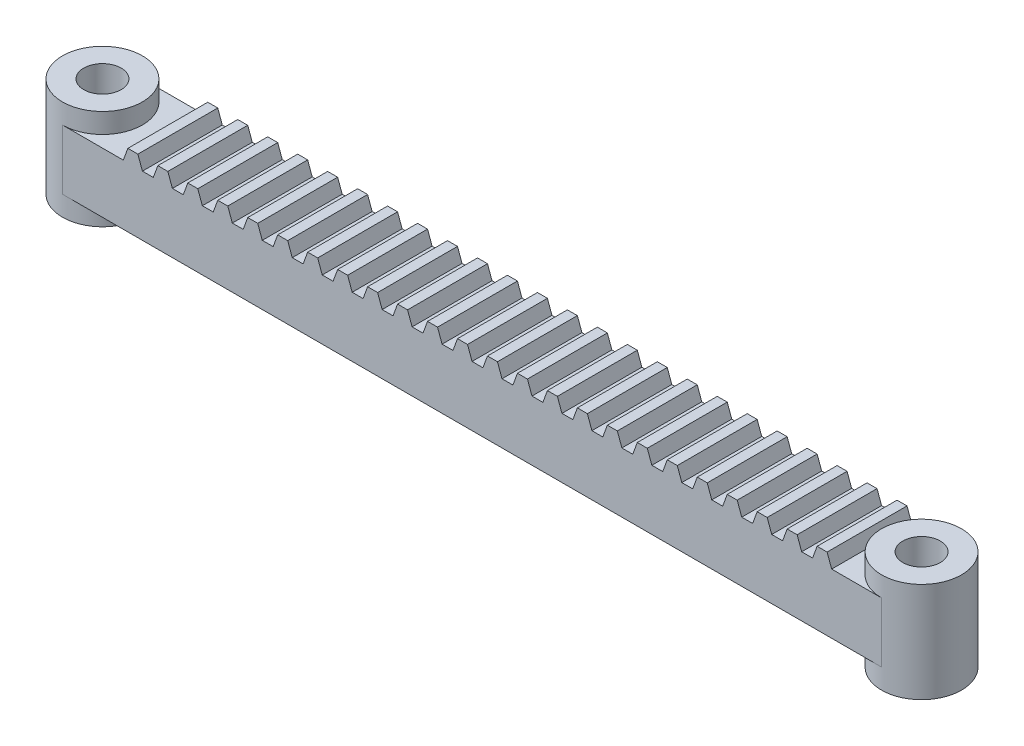
from build123d import *

# Parameters (mm, degrees)
BOSS_EXTRUDE1_DEPTH = 16
BOSS_EXTRUDE2_DEPTH = 16
BOSS_EXTRUDE3_DEPTH = 16
SKETCH2_R           = 8
SKETCH2_R_2         = 3.75
BOSS_EXTRUDE4_DEPTH = 4
BOSS_EXTRUDE5_START = -16
SKETCH2_3_R         = 8
SKETCH2_3_R_2       = 3.75
BOSS_EXTRUDE5_DEPTH = 16
CUT_EXTRUDE1_START  = -16
CUT_EXTRUDE1_DEPTH  = 16
BOSS_EXTRUDE6_START = -16
SKETCH2_5_R         = 8
SKETCH2_5_R_2       = 3.75
BOSS_EXTRUDE6_DEPTH = 16
SKETCH2_6_R         = 8
SKETCH2_6_R_2       = 3.75
BOSS_EXTRUDE7_DEPTH = 4
CUT_EXTRUDE2_START  = -16
SKETCH2_7_R         = 3.75
CUT_EXTRUDE2_DEPTH  = 16


with BuildPart() as part:
    # Sketch1 → Boss-Extrude1 (new body)
    with BuildSketch(Plane.XY):
        Polygon((70.090074414, 0), (70.090074414, 12), (68.180148829, 12), (66, 12), (62.180148829, 12), (60, 12), (56.180148829, 12), (54, 12), (50.180148829, 12), (48, 12), (44.180148829, 12), (42, 12), (38.180148829, 12), (36, 12), (32.180148829, 12), (30, 12), (26.180148829, 12), (24, 12), (20.180148829, 12), (18, 12), (14.180148829, 12), (12, 12), (8.180148829, 12), (6, 12), (2.180148829, 12), (0, 12), (-3.819851171, 12), (-6, 12), (-9.819851171, 12), (-12, 12), (-15.819851171, 12), (-18, 12), (-21.819851171, 12), (-24, 12), (-27.819851171, 12), (-30, 12), (-33.819851171, 12), (-36, 12), (-39.819851171, 12), (-42, 12), (-45.819851171, 12), (-48, 12), (-51.819851171, 12), (-54, 12), (-57.819851171, 12), (-60, 12), (-63.819851171, 12), (-66, 12), (-69.819851171, 12), (-82, 12), (-82, 0), align=None)
    extrude(amount=BOSS_EXTRUDE1_DEPTH)

    # Sketch1<5> → Boss-Extrude2 (add)
    with BuildSketch(Plane.XY):
        Polygon((71.090074414, 14.5), (69.090074414, 14.5), (68.180148829, 12), (70.090074414, 12), (70.090074414, 0), (82, 0), (82, 12), (72, 12), align=None)
        Polygon((62.180148829, 12), (66, 12), (65.090074414, 14.5), (63.090074414, 14.5), align=None)
        Polygon((56.180148829, 12), (60, 12), (59.090074414, 14.5), (57.090074414, 14.5), align=None)
        Polygon((50.180148829, 12), (54, 12), (53.090074414, 14.5), (51.090074414, 14.5), align=None)
        Polygon((44.180148829, 12), (48, 12), (47.090074414, 14.5), (45.090074414, 14.5), align=None)
        Polygon((38.180148829, 12), (42, 12), (41.090074414, 14.5), (39.090074414, 14.5), align=None)
        Polygon((32.180148829, 12), (36, 12), (35.090074414, 14.5), (33.090074414, 14.5), align=None)
        Polygon((26.180148829, 12), (30, 12), (29.090074414, 14.5), (27.090074414, 14.5), align=None)
        Polygon((20.180148829, 12), (24, 12), (23.090074414, 14.5), (21.090074414, 14.5), align=None)
        Polygon((14.180148829, 12), (18, 12), (17.090074414, 14.5), (15.090074414, 14.5), align=None)
        Polygon((8.180148829, 12), (12, 12), (11.090074414, 14.5), (9.090074414, 14.5), align=None)
        Polygon((2.180148829, 12), (6, 12), (5.090074414, 14.5), (3.090074414, 14.5), align=None)
        Polygon((-14.909925586, 14.5), (-15.819851171, 12), (-12, 12), (-12.909925586, 14.5), align=None)
        Polygon((-3.819851171, 12), (0, 12), (-0.909925586, 14.5), (-2.909925586, 14.5), align=None)
        Polygon((-8.909925586, 14.5), (-9.819851171, 12), (-6, 12), (-6.909925586, 14.5), align=None)
    extrude(amount=BOSS_EXTRUDE2_DEPTH)

    # Sketch1<6> → Boss-Extrude3 (add)
    with BuildSketch(Plane.XY):
        Polygon((-68.909925586, 14.5), (-69.819851171, 12), (-66, 12), (-66.909925586, 14.5), align=None)
        Polygon((-62.909925586, 14.5), (-63.819851171, 12), (-60, 12), (-60.909925586, 14.5), align=None)
        Polygon((-56.909925586, 14.5), (-57.819851171, 12), (-54, 12), (-54.909925586, 14.5), align=None)
        Polygon((-50.909925586, 14.5), (-51.819851171, 12), (-48, 12), (-48.909925586, 14.5), align=None)
        Polygon((-44.909925586, 14.5), (-45.819851171, 12), (-42, 12), (-42.909925586, 14.5), align=None)
        Polygon((-38.909925586, 14.5), (-39.819851171, 12), (-36, 12), (-36.909925586, 14.5), align=None)
        Polygon((-32.909925586, 14.5), (-33.819851171, 12), (-30, 12), (-30.909925586, 14.5), align=None)
        Polygon((-26.909925586, 14.5), (-27.819851171, 12), (-24, 12), (-24.909925586, 14.5), align=None)
        Polygon((-20.909925586, 14.5), (-21.819851171, 12), (-18, 12), (-18.909925586, 14.5), align=None)
    extrude(amount=BOSS_EXTRUDE3_DEPTH)

    # Sketch2 → Boss-Extrude4 (add)
    with BuildSketch(Plane(origin=(0, 12, 0), x_dir=(1, 0, 0), z_dir=(0, 1, 0))):
        with Locations((-82, -8)):
            Circle(SKETCH2_R)
        with Locations((-82, -8)):
            Circle(SKETCH2_R_2, mode=Mode.SUBTRACT)
    extrude(amount=BOSS_EXTRUDE4_DEPTH)

    # Sketch2<3> → Boss-Extrude5 (add)
    with BuildSketch(Plane(origin=(0, 12, 0), x_dir=(1, 0, 0), z_dir=(0, 1, 0)).offset(BOSS_EXTRUDE5_START)):
        with Locations((-82, -8)):
            Circle(SKETCH2_3_R)
        with Locations((-82, -8)):
            Circle(SKETCH2_3_R_2, mode=Mode.SUBTRACT)
    extrude(amount=BOSS_EXTRUDE5_DEPTH)

    # Sketch2<4> → Cut-Extrude1 (cut)
    with BuildSketch(Plane(origin=(0, 12, 0), x_dir=(1, 0, 0), z_dir=(0, 1, 0)).offset(CUT_EXTRUDE1_START)):
        with BuildLine():
            ThreePointArc((-78.25, -8), (-79.348349571, -5.348349571), (-82, -4.25))
            Line((-82, -4.25), (-82, -11.75))
            ThreePointArc((-82, -11.75), (-79.348349571, -10.651650429), (-78.25, -8))
        make_face()
    extrude(amount=CUT_EXTRUDE1_DEPTH, mode=Mode.SUBTRACT)

    # Sketch2<5> → Boss-Extrude6 (add)
    # profile 1 of 2: a face of its own
    with BuildSketch(Plane(origin=(0, 12, 0), x_dir=(1, 0, 0), z_dir=(0, 1, 0)).offset(BOSS_EXTRUDE6_START)):
        with Locations((-82, -8)):
            Circle(SKETCH2_5_R)
        with Locations((-82, -8)):
            Circle(SKETCH2_5_R_2, mode=Mode.SUBTRACT)
    # profile 2 of 2: a face of its own
    with BuildSketch(Plane(origin=(0, 12, 0), x_dir=(1, 0, 0), z_dir=(0, 1, 0)).offset(BOSS_EXTRUDE6_START)):
        with Locations((82, -8)):
            Circle(SKETCH2_5_R)
        with Locations((82, -8)):
            Circle(SKETCH2_5_R_2, mode=Mode.SUBTRACT)
    extrude(amount=BOSS_EXTRUDE6_DEPTH)

    # Sketch2<6> → Boss-Extrude7 (add)
    # profile 1 of 2: a face of its own
    with BuildSketch(Plane(origin=(0, 12, 0), x_dir=(1, 0, 0), z_dir=(0, 1, 0))):
        with Locations((-82, -8)):
            Circle(SKETCH2_6_R)
        with Locations((-82, -8)):
            Circle(SKETCH2_6_R_2, mode=Mode.SUBTRACT)
    # profile 2 of 2: a face of its own
    with BuildSketch(Plane(origin=(0, 12, 0), x_dir=(1, 0, 0), z_dir=(0, 1, 0))):
        with Locations((82, -8)):
            Circle(SKETCH2_6_R)
        with Locations((82, -8)):
            Circle(SKETCH2_6_R_2, mode=Mode.SUBTRACT)
    extrude(amount=BOSS_EXTRUDE7_DEPTH)

    # Sketch2<7> → Cut-Extrude2 (cut)
    with BuildSketch(Plane(origin=(0, 12, 0), x_dir=(1, 0, 0), z_dir=(0, 1, 0)).offset(CUT_EXTRUDE2_START)):
        with Locations((82, -8)):
            Circle(SKETCH2_7_R)
    extrude(amount=CUT_EXTRUDE2_DEPTH, mode=Mode.SUBTRACT)


solid = part.part
